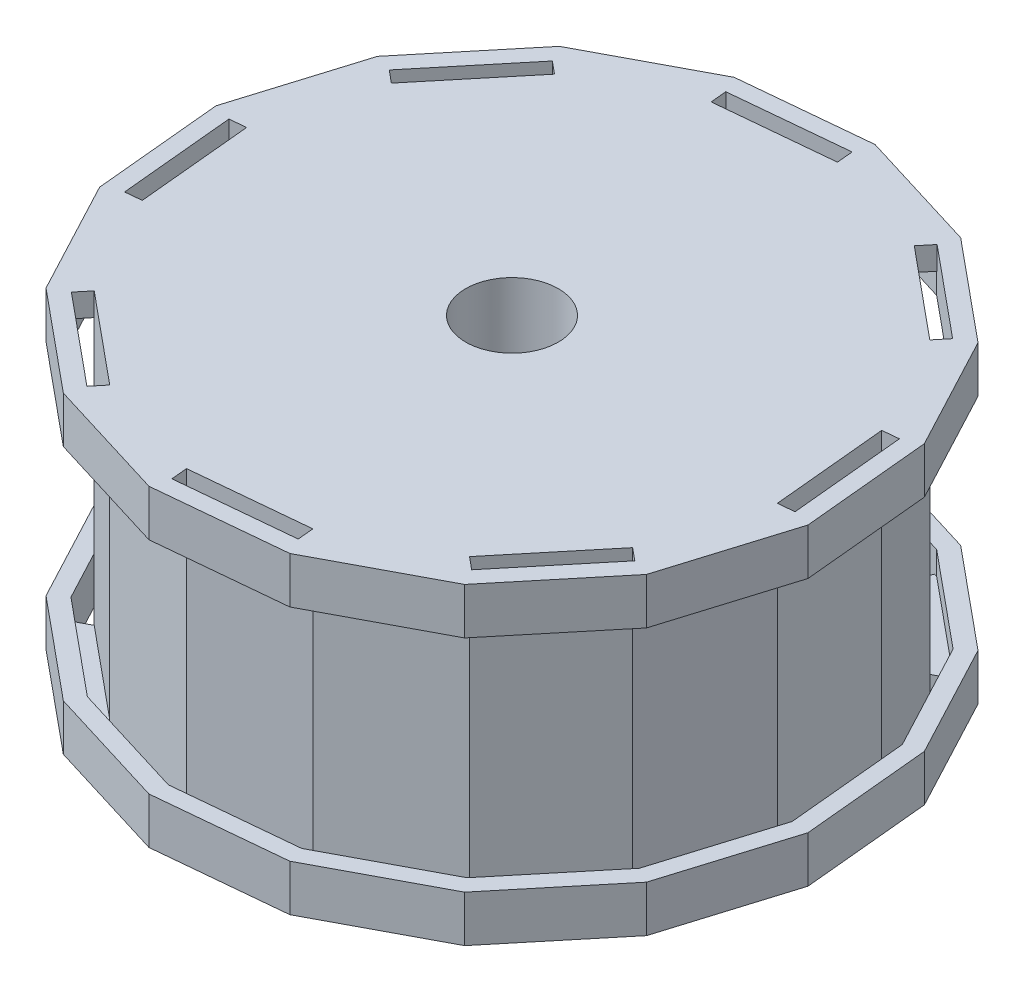
from build123d import *

# Parameters (mm, degrees)
BOSS_EXTRUDE1_DEPTH     = 27
BOSS_EXTRUDE2_DEPTH     = 2
BOSS_EXTRUDE3_DEPTH     = 4
BOSS_EXTRUDE4_DEPTH     = 2
CUT_EXTRUDE1_DEPTH      = 49.441415403
CUT_EXTRUDE1_DEPTH_BACK = 49.441415403
BOSS_EXTRUDE8_DEPTH     = 2
BOSS_EXTRUDE9_DEPTH     = 4
CUT_EXTRUDE2_DEPTH      = 49.441415403
CUT_EXTRUDE2_DEPTH_BACK = 49.441415403
SKETCH5_R               = 4


with BuildPart() as part:
    # Sketch2 → Boss-Extrude1 (new body)
    with BuildSketch(Plane(origin=(0, 0, 0), x_dir=(1, 0, 0), z_dir=(0, 1, 0))):
        Polygon((22.563885141, -12.154202836), (25.497523714, -2.594194221), (24.549395438, 7.360756948), (19.863844247, 16.195099597), (12.154202836, 22.563885141), (2.594194221, 25.497523714), (-7.360756948, 24.549395438), (-16.195099597, 19.863844247), (-22.563885141, 12.154202836), (-25.497523714, 2.594194221), (-24.549395438, -7.360756948), (-19.863844247, -16.195099597), (-12.154202836, -22.563885141), (-2.594194221, -25.497523714), (7.360756948, -24.549395438), (16.195099597, -19.863844247), align=None)
    extrude(amount=BOSS_EXTRUDE1_DEPTH)



with BuildPart() as body_2:
    # Sketch3 → Boss-Extrude2 (new body)
    with BuildSketch(Plane(origin=(0, 27, 0), x_dir=(1, 0, 0), z_dir=(0, 1, 0))):
        Polygon((2.893484263, 28.439151941), (-8.20996139, 27.38163889), (-18.063514845, 22.155519532), (-25.167061911, 13.556423167), (-28.439151941, 2.893484263), (-27.38163889, -8.20996139), (-22.155519532, -18.063514845), (-13.556423167, -25.167061911), (-2.893484263, -28.439151941), (8.20996139, -27.38163889), (18.063514845, -22.155519532), (25.167061911, -13.556423167), (28.439151941, -2.893484263), (27.38163889, 8.20996139), (22.155519532, 18.063514845), (13.556423167, 25.167061911), align=None)
        Polygon((-7.360756948, 24.549395438), (-7.493494906, 25.943088602), (2.461456262, 26.891216878), (2.594194221, 25.497523714), align=None, mode=Mode.SUBTRACT)
        Polygon((-23.643234938, 13.045832812), (-17.274449394, 20.755474224), (-16.195099597, 19.863844247), (-22.563885141, 12.154202836), align=None, mode=Mode.SUBTRACT)
        Polygon((-25.943088602, -7.493494906), (-26.891216878, 2.461456262), (-25.497523714, 2.594194221), (-24.549395438, -7.360756948), align=None, mode=Mode.SUBTRACT)
        Polygon((-13.045832812, -23.643234938), (-20.755474224, -17.274449394), (-19.863844247, -16.195099597), (-12.154202836, -22.563885141), align=None, mode=Mode.SUBTRACT)
        Polygon((7.493494906, -25.943088602), (-2.461456262, -26.891216878), (-2.594194221, -25.497523714), (7.360756948, -24.549395438), align=None, mode=Mode.SUBTRACT)
        Polygon((23.643234938, -13.045832812), (17.274449394, -20.755474224), (16.195099597, -19.863844247), (22.563885141, -12.154202836), align=None, mode=Mode.SUBTRACT)
        Polygon((25.943088602, 7.493494906), (26.891216878, -2.461456262), (25.497523714, -2.594194221), (24.549395438, 7.360756948), align=None, mode=Mode.SUBTRACT)
        Polygon((13.045832812, 23.643234938), (20.755474224, 17.274449394), (19.863844247, 16.195099597), (12.154202836, 22.563885141), align=None, mode=Mode.SUBTRACT)
    extrude(amount=-BOSS_EXTRUDE2_DEPTH)


with BuildPart() as body_3:
    # Sketch4 → Boss-Extrude3 (new body)
    with BuildSketch(Plane(origin=(0, 0, 0), x_dir=(-1, 0, 0), z_dir=(0, -1, 0))):
        Polygon((8.20996139, 27.38163889), (-2.893484263, 28.439151941), (-13.556423167, 25.167061911), (-22.155519532, 18.063514845), (-27.38163889, 8.20996139), (-28.439151941, -2.893484263), (-25.167061911, -13.556423167), (-18.063514845, -22.155519532), (-8.20996139, -27.38163889), (2.893484263, -28.439151941), (13.556423167, -25.167061911), (22.155519532, -18.063514845), (27.38163889, -8.20996139), (28.439151941, 2.893484263), (25.167061911, 13.556423167), (18.063514845, 22.155519532), align=None)
        Polygon((-20.970170247, 17.097093165), (-12.831136789, 23.820591168), (-2.738679069, 26.9176201), (7.770717713, 25.91668538), (17.097093165, 20.970170247), (23.820591168, 12.831136789), (26.9176201, 2.738679069), (25.91668538, -7.770717713), (20.970170247, -17.097093165), (12.831136789, -23.820591168), (2.738679069, -26.9176201), (-7.770717713, -25.91668538), (-17.097093165, -20.970170247), (-23.820591168, -12.831136789), (-26.9176201, -2.738679069), (-25.91668538, 7.770717713), align=None, mode=Mode.SUBTRACT)
    extrude(amount=-BOSS_EXTRUDE3_DEPTH)


with BuildPart() as part_1:
    add(part.part)

    add(body_3.part)  # Boss-Extrude4 merges body 3
    # Sketch4<4> → Boss-Extrude4 (add)
    with BuildSketch(Plane(origin=(0, 0, 0), x_dir=(-1, 0, 0), z_dir=(0, -1, 0))):
        Polygon((-2.738679069, 26.9176201), (-12.831136789, 23.820591168), (-20.970170247, 17.097093165), (-25.91668538, 7.770717713), (-26.9176201, -2.738679069), (-23.820591168, -12.831136789), (-17.097093165, -20.970170247), (-7.770717713, -25.91668538), (2.738679069, -26.9176201), (12.831136789, -23.820591168), (20.970170247, -17.097093165), (25.91668538, -7.770717713), (26.9176201, 2.738679069), (23.820591168, 12.831136789), (17.097093165, 20.970170247), (7.770717713, 25.91668538), align=None)
        Polygon((-12.154202836, 22.563885141), (-2.594194221, 25.497523714), (7.360756948, 24.549395438), (16.195099597, 19.863844247), (22.563885141, 12.154202836), (25.497523714, 2.594194221), (24.549395438, -7.360756948), (19.863844247, -16.195099597), (12.154202836, -22.563885141), (2.594194221, -25.497523714), (-7.360756948, -24.549395438), (-16.195099597, -19.863844247), (-22.563885141, -12.154202836), (-25.497523714, -2.594194221), (-24.549395438, 7.360756948), (-19.863844247, 16.195099597), align=None, mode=Mode.SUBTRACT)
    extrude(amount=-BOSS_EXTRUDE4_DEPTH)


with BuildPart() as cut_extrude1_tool:
    # Sketch3<3> → Cut-Extrude1 (new, two sides: drawn at the far end of the back side and taken through both)
    with BuildSketch(Plane(origin=(0, 27, 0), x_dir=(1, 0, 0), z_dir=(0, 1, 0)).offset(-CUT_EXTRUDE1_DEPTH_BACK)):
        Polygon((-16.195099597, 19.863844247), (-7.360756948, 24.549395438), (-8.016734114, 25.786203409), (-16.851076763, 21.100652218), align=None)
        Polygon((3.004903621, 26.835924921), (2.594194221, 25.497523714), (12.154202836, 22.563885141), (12.564912236, 23.902286347), align=None)
        Polygon((-25.497523714, 2.594194221), (-22.563885141, 12.154202836), (-23.902286347, 12.564912236), (-26.835924921, 3.004903621), align=None)
        Polygon((21.100652218, 16.851076763), (19.863844247, 16.195099597), (24.549395438, 7.360756948), (25.786203409, 8.016734114), align=None)
        Polygon((-19.863844247, -16.195099597), (-24.549395438, -7.360756948), (-25.786203409, -8.016734114), (-21.100652218, -16.851076763), align=None)
        Polygon((26.835924921, -3.004903621), (25.497523714, -2.594194221), (22.563885141, -12.154202836), (23.902286347, -12.564912236), align=None)
        Polygon((-2.594194221, -25.497523714), (-12.154202836, -22.563885141), (-12.564912236, -23.902286347), (-3.004903621, -26.835924921), align=None)
        Polygon((16.851076763, -21.100652218), (16.195099597, -19.863844247), (7.360756948, -24.549395438), (8.016734114, -25.786203409), align=None)
    extrude(amount=CUT_EXTRUDE1_DEPTH + CUT_EXTRUDE1_DEPTH_BACK)


with BuildPart() as part_2:
    add(part_1.part)

    # Cut-Extrude1: cut by cut_extrude1_tool
    add(cut_extrude1_tool.part, mode=Mode.SUBTRACT)



with BuildPart() as body_2_1:
    add(body_2.part)

    # Cut-Extrude1: cut by cut_extrude1_tool
    add(cut_extrude1_tool.part, mode=Mode.SUBTRACT)


with BuildPart() as part_3:
    add(part_2.part)

    add(body_2_1.part)  # Boss-Extrude8 merges body 2
    # Sketch3<5> → Boss-Extrude8 (add)
    with BuildSketch(Plane(origin=(0, 27, 0), x_dir=(1, 0, 0), z_dir=(0, 1, 0))):
        Polygon((-16.195099597, 19.863844247), (-7.360756948, 24.549395438), (-8.016734114, 25.786203409), (-16.851076763, 21.100652218), align=None)
        Polygon((3.004903621, 26.835924921), (2.594194221, 25.497523714), (12.154202836, 22.563885141), (12.564912236, 23.902286347), align=None)
        Polygon((-25.497523714, 2.594194221), (-22.563885141, 12.154202836), (-23.902286347, 12.564912236), (-26.835924921, 3.004903621), align=None)
        Polygon((21.100652218, 16.851076763), (19.863844247, 16.195099597), (24.549395438, 7.360756948), (25.786203409, 8.016734114), align=None)
        Polygon((-19.863844247, -16.195099597), (-24.549395438, -7.360756948), (-25.786203409, -8.016734114), (-21.100652218, -16.851076763), align=None)
        Polygon((26.835924921, -3.004903621), (25.497523714, -2.594194221), (22.563885141, -12.154202836), (23.902286347, -12.564912236), align=None)
        Polygon((-2.594194221, -25.497523714), (-12.154202836, -22.563885141), (-12.564912236, -23.902286347), (-3.004903621, -26.835924921), align=None)
        Polygon((16.851076763, -21.100652218), (16.195099597, -19.863844247), (7.360756948, -24.549395438), (8.016734114, -25.786203409), align=None)
    extrude(amount=-BOSS_EXTRUDE8_DEPTH)

    # Sketch3<6> → Boss-Extrude9 (add)
    with BuildSketch(Plane(origin=(0, 27, 0), x_dir=(1, 0, 0), z_dir=(0, 1, 0))):
        Polygon((2.893484263, 28.439151941), (-8.20996139, 27.38163889), (-18.063514845, 22.155519532), (-25.167061911, 13.556423167), (-28.439151941, 2.893484263), (-27.38163889, -8.20996139), (-22.155519532, -18.063514845), (-13.556423167, -25.167061911), (-2.893484263, -28.439151941), (8.20996139, -27.38163889), (18.063514845, -22.155519532), (25.167061911, -13.556423167), (28.439151941, -2.893484263), (27.38163889, 8.20996139), (22.155519532, 18.063514845), (13.556423167, 25.167061911), align=None)
        Polygon((-7.770717713, 25.91668538), (-7.493494906, 25.943088602), (-4.248833717, 26.252116237), (2.461456262, 26.891216878), (2.738679069, 26.9176201), (3.004903621, 26.835924921), (12.564912236, 23.902286347), (12.831136789, 23.820591168), (13.045832812, 23.643234938), (20.755474224, 17.274449394), (20.970170247, 17.097093165), (21.100652218, 16.851076763), (25.786203409, 8.016734114), (25.91668538, 7.770717713), (25.943088602, 7.493494906), (26.891216878, -2.461456262), (26.9176201, -2.738679069), (26.835924921, -3.004903621), (23.902286347, -12.564912236), (23.820591168, -12.831136789), (23.643234938, -13.045832812), (17.274449394, -20.755474224), (17.097093165, -20.970170247), (16.851076763, -21.100652218), (8.016734114, -25.786203409), (7.770717713, -25.91668538), (7.493494906, -25.943088602), (-2.461456262, -26.891216878), (-2.738679069, -26.9176201), (-3.004903621, -26.835924921), (-12.564912236, -23.902286347), (-12.831136789, -23.820591168), (-13.045832812, -23.643234938), (-20.755474224, -17.274449394), (-20.970170247, -17.097093165), (-21.100652218, -16.851076763), (-25.786203409, -8.016734114), (-25.91668538, -7.770717713), (-25.943088602, -7.493494906), (-26.891216878, 2.461456262), (-26.9176201, 2.738679069), (-26.835924921, 3.004903621), (-23.902286347, 12.564912236), (-23.820591168, 12.831136789), (-23.643234938, 13.045832812), (-17.274449394, 20.755474224), (-17.097093165, 20.970170247), (-16.851076763, 21.100652218), (-8.016734114, 25.786203409), align=None, mode=Mode.SUBTRACT)
    extrude(amount=-BOSS_EXTRUDE9_DEPTH)

    # Sketch5 → Cut-Extrude2 (cut, two sides: drawn at the far end of the back side and taken through both)
    with BuildSketch(Plane.XZ.offset(-CUT_EXTRUDE2_DEPTH_BACK)):
        Circle(SKETCH5_R)
    extrude(amount=CUT_EXTRUDE2_DEPTH + CUT_EXTRUDE2_DEPTH_BACK, mode=Mode.SUBTRACT)


solid = part_3.part
